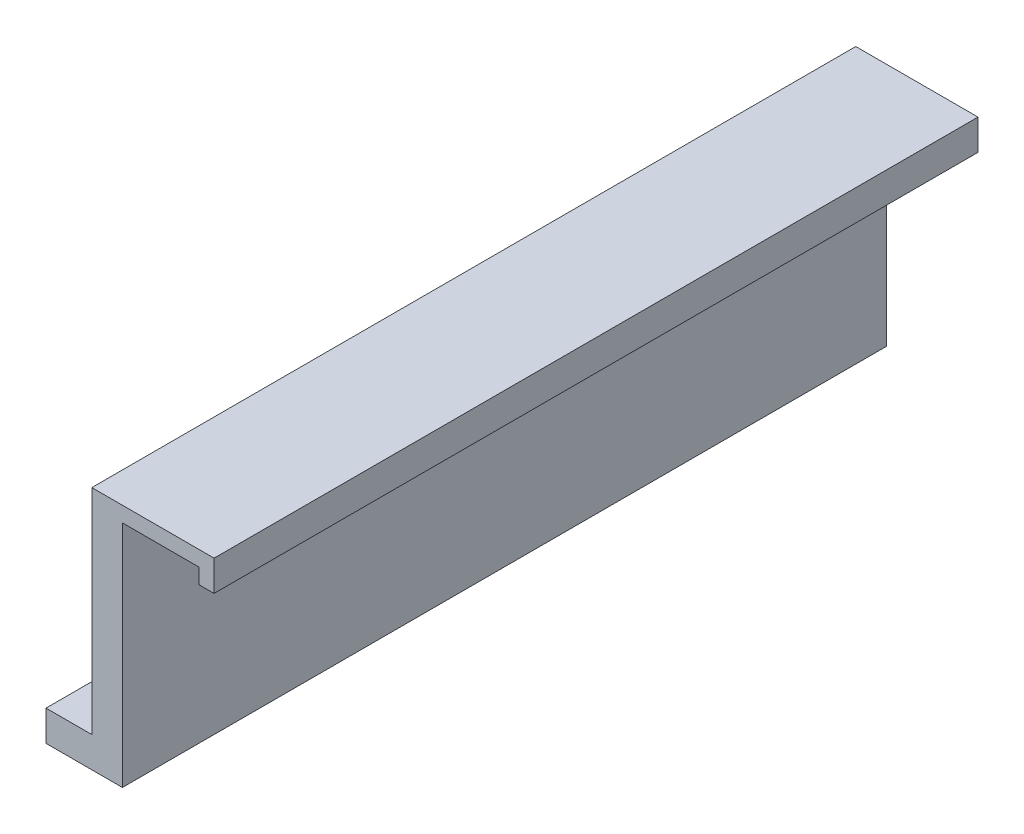
from build123d import *

# Parameters (mm, degrees)
SKETCH1_W            = 100
SKETCH1_H            = 26
BOSS_EXTRUDE1_DEPTH  = 2
BOSS_EXTRUDE2_DEPTH  = 100
MOVE_START           = -100
MOVE_FACE1_OUTLINE_W = 2
MOVE_FACE1_OUTLINE_H = 28
MOVE_FACE1_DEPTH     = 100
SKETCH5_W            = 100
SKETCH5_H            = 4
BOSS_EXTRUDE3_DEPTH  = 6
SKETCH6_W            = 100
SKETCH6_H            = 4
BOSS_EXTRUDE4_DEPTH  = 4


# Read off the part's stored shape, not the designer's step: Move Face1
with BuildPart() as part:
    # Sketch1 → Boss-Extrude1 (new body)
    with BuildSketch(Plane(origin=(0, 0, 0), x_dir=(0, 0, -1), z_dir=(1, 0, 0))):
        with Locations((50, 13)):
            Rectangle(SKETCH1_W, SKETCH1_H)
    extrude(amount=BOSS_EXTRUDE1_DEPTH)

    # Sketch2 → Boss-Extrude2 (add)
    with BuildSketch(Plane.XY):
        Polygon((2, 26), (2, 28), (-12, 28), (-12, 24), (-10, 24), (-10, 26), align=None)
    extrude(amount=-BOSS_EXTRUDE2_DEPTH)


with BuildPart() as body_2:
    # Mirror1: mirrored copy
    add(part.part.mirror(Plane.ZY.offset(-2)))

    # Move Face1 outline → Move Face1 (add)
    with BuildSketch(Plane.XY.offset(MOVE_START)):
        with Locations((1, 14)):
            Rectangle(MOVE_FACE1_OUTLINE_W, MOVE_FACE1_OUTLINE_H)
    extrude(amount=MOVE_FACE1_DEPTH)



with BuildPart() as body_2_2:
    # Sketch5 → Boss-Extrude3 (new body)
    with BuildSketch(Plane.ZY):
        with Locations((-50, -2)):
            Rectangle(SKETCH5_W, SKETCH5_H)
    extrude(amount=BOSS_EXTRUDE3_DEPTH)


with BuildPart() as body_2_1:
    add(body_2.part)

    add(body_2_2.part)  # Boss-Extrude4 merges body 2 2
    # Sketch6 → Boss-Extrude4 (add)
    with BuildSketch(Plane(origin=(0, 0, 0), x_dir=(0, 0, -1), z_dir=(1, 0, 0))):
        with Locations((50, -2)):
            Rectangle(SKETCH6_W, SKETCH6_H)
    extrude(amount=BOSS_EXTRUDE4_DEPTH)


solid = body_2_1.part
